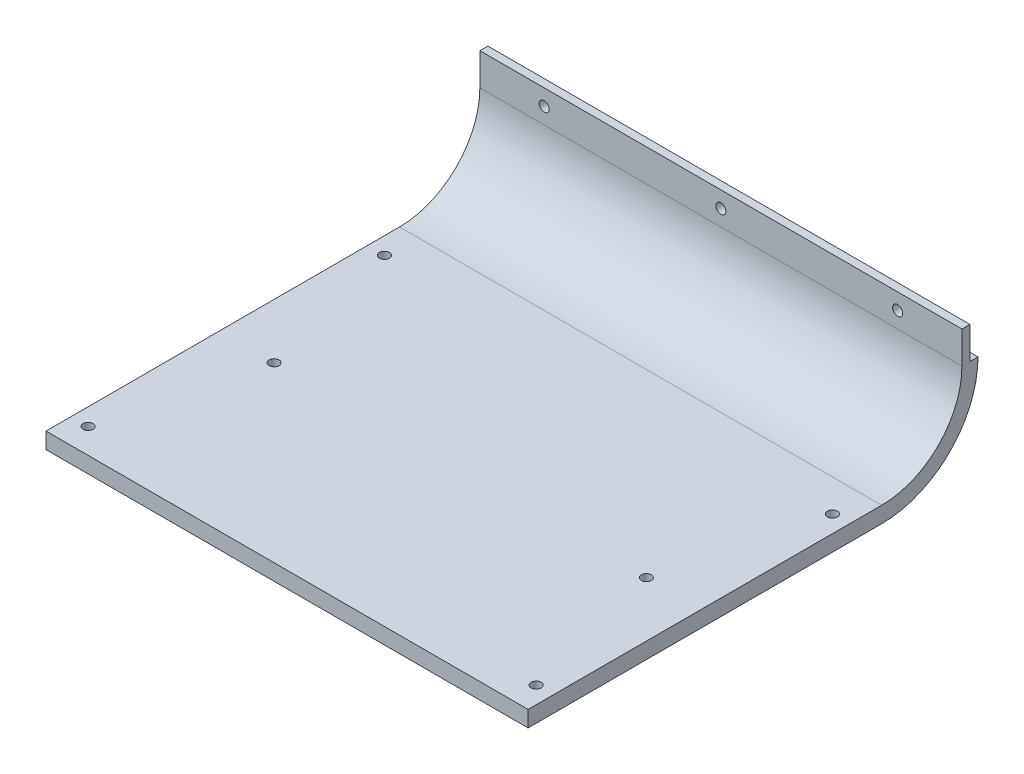
from build123d import *

# Parameters (mm, degrees)
BOSS_EXTRUDE1_DEPTH      = 190.5
BOSS_EXTRUDE1_DEPTH_BACK = 190.5
SKETCH2_W                = 381
SKETCH2_H                = 6.35
BOSS_EXTRUDE2_DEPTH      = 25.4
SKETCH3_R                = 3.96875
CUT_EXTRUDE1_DEPTH       = 25.4
SKETCH4_R                = 3.937
CUT_EXTRUDE2_DEPTH       = 302.34078715


with BuildPart() as part:
    # Sketch1 → Boss-Extrude1 (new, two sides: drawn at the far end of the back side and taken through both)
    with BuildSketch(Plane(origin=(0, 0, 0), x_dir=(0, 0, -1), z_dir=(1, 0, 0)).offset(-BOSS_EXTRUDE1_DEPTH_BACK)):
        with BuildLine():
            Line((-139.7, 0), (139.7, 0))
            ThreePointArc((139.7, 0), (193.581536726, 22.318463274), (215.9, 76.2))
            Line((215.9, 76.2), (203.2, 76.2))
            ThreePointArc((203.2, 76.2), (184.601280605, 31.298719395), (139.7, 12.7))
            Line((139.7, 12.7), (-139.7, 12.7))
            Line((-139.7, 12.7), (-139.7, 0))
        make_face()
    extrude(amount=BOSS_EXTRUDE1_DEPTH + BOSS_EXTRUDE1_DEPTH_BACK)

    # Sketch2 → Boss-Extrude2 (add)
    with BuildSketch(Plane(origin=(0, 76.2, 0), x_dir=(1, 0, 0), z_dir=(0, 1, 0))):
        with Locations((0, 206.375)):
            Rectangle(SKETCH2_W, SKETCH2_H)
    extrude(amount=BOSS_EXTRUDE2_DEPTH)

    # Sketch3 → Cut-Extrude1 (cut)
    with BuildSketch(Plane(origin=(0, 0, -209.55), x_dir=(-1, 0, 0), z_dir=(0, 0, -1))):
        with Locations((-139.7, 88.9)):
            Circle(SKETCH3_R)
        with Locations((139.7, 88.9)):
            Circle(SKETCH3_R)
        with Locations((0, 88.9)):
            Circle(SKETCH3_R)
    extrude(amount=-CUT_EXTRUDE1_DEPTH, mode=Mode.SUBTRACT)

    # Sketch4 → Cut-Extrude2 (cut, through all)
    with BuildSketch(Plane(origin=(0, 12.7, 0), x_dir=(1, 0, 0), z_dir=(0, 1, 0))):
        with Locations((177.038, -119.888)):
            Circle(SKETCH4_R)
        with Locations((177.038, 114.3)):
            Circle(SKETCH4_R)
        with Locations((-177.038, -119.888)):
            Circle(SKETCH4_R)
        with Locations((-177.038, 114.3)):
            Circle(SKETCH4_R)
        with Locations((147.066, -2.794)):
            Circle(SKETCH4_R)
        with Locations((-147.066, -2.794)):
            Circle(SKETCH4_R)
    extrude(amount=-CUT_EXTRUDE2_DEPTH, mode=Mode.SUBTRACT)


solid = part.part
